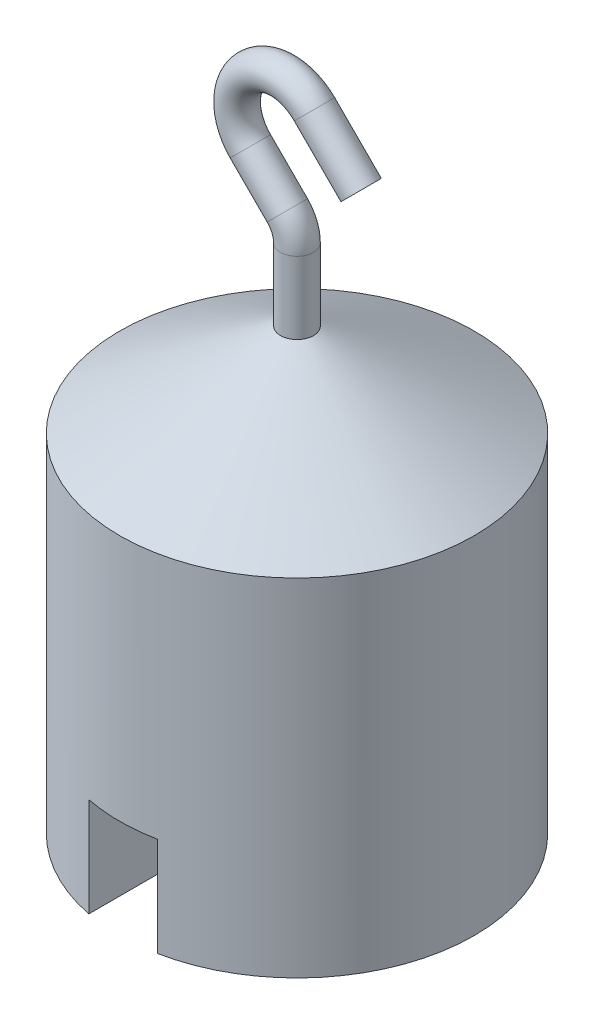
from build123d import *

# Parameters (mm, degrees)
SKETCH2_R               = 2
CUT_EXTRUDE1_DEPTH      = 94.938434637
CUT_EXTRUDE1_DEPTH_BACK = 94.938434637
SKETCH10_W              = 8.3
SKETCH10_H              = 12
BOSS_EXTRUDE1_REACH     = 89.369
SKETCH11_R              = 1.5
SKETCH13_W              = 15
SKETCH13_H              = 6
CUT_EXTRUDE2_DEPTH      = 1.25
CUT_EXTRUDE3_DEPTH      = 0.5


with BuildPart() as part:
    # Sketch1 → Revolve1 (revolve)
    with BuildSketch(Plane.XY):
        Polygon((0, 0), (0, 42), (19.5, 53.258330249), (21.5, 53.258330249), (21.5, 0), align=None)
    revolve(axis=Axis((21.5, 53.258330249, 0), (0, -1, 0)))

    # Sweep6: sweep along a path in Sketch3
    with BuildLine(Plane.XY) as sweep6_path:
        Line((29.278174593, 71.436504842), (23.621320344, 77.093359092))
        ThreePointArc((23.621320344, 77.093359092), (15.843145751, 77.093359092), (15.843145751, 69.315184499))
        Line((15.843145751, 69.315184499), (20.328427125, 64.829903124))
        ThreePointArc((20.328427125, 64.829903124), (21.19551813, 63.532209729), (21.5, 62.001476))
        Line((21.5, 62.001476), (21.5, 53.258330249))
    # Sketch2 → Sweep6 (sweep)
    with BuildSketch(Plane(origin=(0, 53.258330249, 0), x_dir=(1, 0, 0), z_dir=(0, 1, 0))):
        with Locations((21.5, 0)):
            Circle(SKETCH2_R)
    sweep(path=sweep6_path.line)

    # Sketch10 → Cut-Extrude1 (cut, two sides: drawn at the far end of the back side and taken through both)
    with BuildSketch(Plane.XY.offset(-CUT_EXTRUDE1_DEPTH_BACK)):
        with Locations((21.5, 6)):
            Rectangle(SKETCH10_W, SKETCH10_H)
    extrude(amount=CUT_EXTRUDE1_DEPTH + CUT_EXTRUDE1_DEPTH_BACK, mode=Mode.SUBTRACT)

    # Sketch11 → Boss-Extrude1 (add, up to next)
    with BuildSketch(Plane.ZY.offset(-25.65), mode=Mode.PRIVATE) as boss_extrude1_sk1:
        with Locations((0, 4.5)):
            Circle(SKETCH11_R)
    boss_extrude1_tool1 = extrude(boss_extrude1_sk1.sketch, amount=BOSS_EXTRUDE1_REACH, mode=Mode.PRIVATE) - part.part
    add(boss_extrude1_tool1.solids().sort_by_distance((25.65, 4.5, 0))[0])

    # Sketch13 → Cut-Extrude2 (cut)
    with BuildSketch(Plane.ZY):
        with Locations((0, 30)):
            Rectangle(SKETCH13_W, SKETCH13_H)
    extrude(amount=-CUT_EXTRUDE2_DEPTH, mode=Mode.SUBTRACT)

    # Sketch14 → Cut-Extrude3 (cut)
    # profile 1 of 4: a face of its own
    with BuildSketch(Plane.ZY.offset(-1.25)):
        with BuildLine():
            Line((-1.705128205, 31.5), (-1.705128205, 31.141025641))
            Line((-1.705128205, 31.141025641), (-2.895633013, 31.141025641))
            Line((-2.895633013, 31.141025641), (-3.084234776, 30.220452724))
            add(Edge.make_bspline(
                [(-3.084234776, 30.220452724), (-3.047178901, 30.230682996), (-2.975389005, 30.25050253), (-2.869429144, 30.2725083), (-2.768836941, 30.285773744), (-2.703561571, 30.287585055), (-2.67197516, 30.288461538)],
                knots=[0, 0, 0, 0, 1.100273476, 2.13160584, 3.095893838, 4, 4, 4, 4], degree=3))
            add(Edge.make_bspline(
                [(-2.67197516, 30.288461538), (-2.632891421, 30.287615603), (-2.556043023, 30.285952282), (-2.443604076, 30.269980432), (-2.336271183, 30.244840518), (-2.234268813, 30.209719996), (-2.137408262, 30.164810263), (-2.046580701, 30.108710322), (-1.960422788, 30.043176991), (-1.880480194, 29.967831979), (-1.807955886, 29.884910363), (-1.744189896, 29.795752492), (-1.690027306, 29.701224829), (-1.646466551, 29.600424221), (-1.611682216, 29.494465067), (-1.588530222, 29.382232485), (-1.573113513, 29.264784365), (-1.571391126, 29.184479795), (-1.570512821, 29.143529647)],
                knots=[0, 0, 0, 0, 1.052922333, 2.070308379, 3.05430497, 4.020497103, 4.973039431, 5.925935799, 6.892292201, 7.88610001, 8.88166317, 9.857072816, 10.836096531, 11.812156883, 12.81219415, 13.836441305, 14.89672472, 16, 16, 16, 16], degree=3))
            add(Edge.make_bspline(
                [(-1.570512821, 29.143529647), (-1.571177896, 29.115007427), (-1.572499058, 29.05834844), (-1.579217646, 28.974204239), (-1.592153362, 28.891841406), (-1.609521086, 28.811249014), (-1.632063504, 28.732579642), (-1.659352558, 28.655608114), (-1.692748586, 28.580813507), (-1.729379961, 28.507488112), (-1.770626439, 28.437289605), (-1.816404946, 28.371640618), (-1.864770437, 28.309556337), (-1.916811823, 28.251702604), (-1.973012818, 28.198459586), (-2.032692785, 28.149511304), (-2.095375504, 28.104029974), (-2.162030746, 28.063861779), (-2.231173229, 28.026898823), (-2.303801446, 27.996575285), (-2.378262147, 27.969464757), (-2.455627022, 27.94785523), (-2.535720835, 27.930922675), (-2.618675611, 27.919422075), (-2.704056281, 27.911045637), (-2.761931293, 27.91052128), (-2.791165865, 27.91025641)],
                knots=[0, 0, 0, 0, 1.056347294, 2.098418968, 3.122841568, 4.141288669, 5.149314143, 6.15115421, 7.162517403, 8.180376062, 9.185164535, 10.17417709, 11.141909838, 12.097768115, 13.052685741, 14.0056014, 14.954263652, 15.917497458, 16.885230207, 17.854509472, 18.828990115, 19.81800267, 20.826176721, 21.857883937, 22.917946725, 24, 24, 24, 24], degree=3))
            add(Edge.make_bspline(
                [(-2.791165865, 27.91025641), (-2.826040046, 27.910947248), (-2.894650877, 27.91230639), (-2.995171444, 27.926524876), (-3.09188605, 27.946888792), (-3.184016151, 27.977525062), (-3.272387414, 28.015912357), (-3.355810132, 28.064428528), (-3.436415908, 28.119407632), (-3.510927945, 28.184287985), (-3.580084058, 28.255203667), (-3.641990567, 28.332161308), (-3.697124144, 28.41389075), (-3.744601891, 28.500788904), (-3.785099912, 28.592627435), (-3.816914901, 28.689750436), (-3.842593256, 28.79165044), (-3.853456676, 28.86180395), (-3.858974359, 28.897435897)],
                knots=[0, 0, 0, 0, 1.0467383, 2.05933395, 3.04377827, 4.011590433, 4.970194871, 5.932262533, 6.905835911, 7.896367577, 8.894135286, 9.877477877, 10.858688626, 11.851381753, 12.8477658, 13.868841284, 14.917554742, 16, 16, 16, 16], degree=3))
            Line((-3.858974359, 28.897435897), (-3.544871795, 28.897435897))
            add(Edge.make_bspline(
                [(-3.544871795, 28.897435897), (-3.537143237, 28.864059445), (-3.522288521, 28.79990805), (-3.489682772, 28.709776709), (-3.449816897, 28.629457485), (-3.402412548, 28.557887902), (-3.345862518, 28.495478905), (-3.281333089, 28.439861843), (-3.208985366, 28.389686713), (-3.128592136, 28.347863946), (-3.043779057, 28.312195193), (-2.955011847, 28.288443498), (-2.8647075, 28.271742605), (-2.80362913, 28.270070844), (-2.772936699, 28.269230769)],
                knots=[0, 0, 0, 0, 1.136247022, 2.183929868, 3.172523383, 4.106158343, 5.02341133, 5.958108904, 6.928429099, 7.938127109, 8.96079061, 9.975095812, 10.982467395, 12, 12, 12, 12], degree=3))
            add(Edge.make_bspline(
                [(-2.772936699, 28.269230769), (-2.742978254, 28.270051547), (-2.683989832, 28.271667666), (-2.597178445, 28.284106678), (-2.513365571, 28.303264249), (-2.433378214, 28.331934104), (-2.355816675, 28.366778822), (-2.282642904, 28.411493898), (-2.211740027, 28.462953917), (-2.145311894, 28.521910547), (-2.084472445, 28.586880241), (-2.030716323, 28.656357635), (-1.98593941, 28.730474481), (-1.948205301, 28.807947634), (-1.919552002, 28.889626191), (-1.899111021, 28.975127366), (-1.887107962, 29.064662347), (-1.885456782, 29.125731656), (-1.884615385, 29.156850962)],
                knots=[0, 0, 0, 0, 1.027316725, 2.022795036, 3.002884548, 3.971462791, 4.93288096, 5.914575861, 6.907176829, 7.935150275, 8.956128384, 9.956726525, 10.942570165, 11.921478529, 12.907843606, 13.90538589, 14.932640048, 16, 16, 16, 16], degree=3))
            add(Edge.make_bspline(
                [(-1.884615385, 29.156850962), (-1.885273864, 29.184926713), (-1.886562744, 29.239881002), (-1.897093314, 29.320280209), (-1.915410287, 29.396353251), (-1.940834167, 29.468467485), (-1.973113674, 29.536690927), (-2.012559987, 29.601093987), (-2.059913385, 29.660827821), (-2.114005273, 29.715920374), (-2.173263314, 29.766765249), (-2.238707057, 29.810109336), (-2.308966983, 29.846573253), (-2.383196583, 29.878041252), (-2.463161482, 29.900641997), (-2.547278114, 29.917609882), (-2.636454822, 29.927425245), (-2.69742551, 29.928787134), (-2.728766026, 29.929487179)],
                knots=[0, 0, 0, 0, 1.045622112, 2.046656509, 3.013763289, 3.955457236, 4.890082067, 5.820317437, 6.762574623, 7.722996705, 8.69280354, 9.665887285, 10.63943826, 11.638615906, 12.663482002, 13.728887084, 14.832589034, 16, 16, 16, 16], degree=3))
            add(Edge.make_bspline(
                [(-2.728766026, 29.929487179), (-2.755894954, 29.928906588), (-2.81190931, 29.927707815), (-2.897832137, 29.918881318), (-2.988123859, 29.904642024), (-3.082438355, 29.885055776), (-3.181058863, 29.859424699), (-3.283777264, 29.828710199), (-3.39080953, 29.7919882), (-3.462927255, 29.764255986), (-3.5, 29.75)],
                knots=[0, 0, 0, 0, 0.817624296, 1.688186739, 2.600797293, 3.572016777, 4.590301741, 5.671205678, 6.80286297, 8, 8, 8, 8], degree=3))
            Line((-3.5, 29.75), (-3.141025641, 31.5))
            Line((-3.141025641, 31.5), (-1.705128205, 31.5))
        make_face()
    # profile 2 of 4: a face of its own
    with BuildSketch(Plane.ZY.offset(-1.25)):
        with BuildLine():
            add(Edge.make_bspline(
                [(-1.211538462, 29.748597756), (-1.211210443, 29.804695144), (-1.210573263, 29.913665128), (-1.203484842, 30.07244977), (-1.1917095, 30.221410059), (-1.175572127, 30.360553125), (-1.155934147, 30.48991489), (-1.12971866, 30.609149647), (-1.099905858, 30.718809254), (-1.065353412, 30.819251302), (-1.026365623, 30.911829005), (-0.983931362, 30.998254207), (-0.936366568, 31.078396139), (-0.886389655, 31.153533929), (-0.831977583, 31.222437624), (-0.774678793, 31.286080287), (-0.712256917, 31.342991037), (-0.646833908, 31.394837339), (-0.577817444, 31.440286811), (-0.507174778, 31.48031955), (-0.434419672, 31.514519417), (-0.359353489, 31.541409853), (-0.282650931, 31.5636207), (-0.204043864, 31.578809647), (-0.1234025, 31.588366556), (-0.068971066, 31.589280224), (-0.041366186, 31.58974359)],
                knots=[0, 0, 0, 0, 1.646270934, 3.197905019, 4.663502075, 6.030701355, 7.308322542, 8.50163776, 9.611534131, 10.641858119, 11.616356847, 12.558055219, 13.465016945, 14.349605745, 15.204443733, 16.039544428, 16.859896111, 17.680448484, 18.487036065, 19.28249412, 20.06191084, 20.843045899, 21.620316918, 22.403196591, 23.190181807, 24, 24, 24, 24], degree=3))
            add(Edge.make_bspline(
                [(-0.041366186, 31.58974359), (-0.013530707, 31.589255775), (0.041825301, 31.588285664), (0.123665677, 31.578961721), (0.203615358, 31.563490598), (0.281333497, 31.541569623), (0.357458484, 31.514373947), (0.431394891, 31.48028683), (0.503601973, 31.440607962), (0.57293226, 31.393984085), (0.640146876, 31.342001809), (0.703594839, 31.28323914), (0.763281925, 31.218289421), (0.81995723, 31.147847557), (0.872012827, 31.070562472), (0.921586259, 30.987778362), (0.965958295, 30.898047497), (1.008692971, 30.80286703), (1.045579957, 30.699603371), (1.078846203, 30.58883861), (1.105725171, 30.469264423), (1.128114443, 30.341508178), (1.145459339, 30.205100695), (1.158091981, 30.060334379), (1.164765067, 29.907113989), (1.166021768, 29.80235614), (1.166666667, 29.748597756)],
                knots=[0, 0, 0, 0, 0.810914788, 1.612654377, 2.396697861, 3.181598691, 3.963628158, 4.749916497, 5.551656086, 6.361998678, 7.18212741, 8.025565596, 8.878627764, 9.750805457, 10.657531673, 11.591944965, 12.560506719, 13.57287815, 14.630710178, 15.753379473, 16.941251878, 18.199788006, 19.531962791, 20.947069417, 22.433333509, 24, 24, 24, 24], degree=3))
            add(Edge.make_bspline(
                [(1.166666667, 29.748597756), (1.166015082, 29.695073848), (1.164745496, 29.590784697), (1.158166789, 29.438253721), (1.145208158, 29.294255678), (1.12899817, 29.158445216), (1.106547207, 29.031387597), (1.078942041, 28.912643148), (1.048291718, 28.801699077), (1.010456924, 28.699464265), (0.969046213, 28.604512542), (0.923991017, 28.515845394), (0.875721191, 28.432679101), (0.823132446, 28.355679354), (0.767079033, 28.284300697), (0.706361244, 28.219803074), (0.642690659, 28.160632402), (0.575278243, 28.107980775), (0.504866692, 28.06189597), (0.432907615, 28.02068212), (0.358124232, 27.987449425), (0.282211279, 27.958914384), (0.204082913, 27.937113932), (0.123836522, 27.922040077), (0.041880286, 27.911468228), (-0.013521279, 27.910661748), (-0.041366186, 27.91025641)],
                knots=[0, 0, 0, 0, 1.561518951, 3.042555995, 4.452378317, 5.7783523, 7.031515105, 8.214008947, 9.334062868, 10.386615937, 11.391082383, 12.354592575, 13.286541444, 14.194233754, 15.072674879, 15.931287219, 16.775624067, 17.606195743, 18.42308326, 19.229000347, 20.022332153, 20.807536673, 21.593273796, 22.3848459, 23.188221202, 24, 24, 24, 24], degree=3))
            add(Edge.make_bspline(
                [(-0.041366186, 27.91025641), (-0.0689703, 27.910722766), (-0.123400225, 27.911642328), (-0.20405265, 27.921156059), (-0.282335094, 27.936451562), (-0.358633848, 27.957868166), (-0.433340363, 27.984083003), (-0.505436649, 28.018236686), (-0.575724333, 28.057570755), (-0.644015889, 28.102366177), (-0.70902805, 28.15368786), (-0.771126655, 28.210452149), (-0.828751674, 28.27407556), (-0.88238577, 28.343553483), (-0.933359858, 28.418246725), (-0.980249232, 28.499175098), (-1.023620086, 28.586017709), (-1.063263576, 28.67933562), (-1.09841224, 28.780490547), (-1.129459948, 28.890639726), (-1.153974105, 29.010755362), (-1.174957061, 29.139872729), (-1.191881444, 29.278546659), (-1.203435769, 29.426852438), (-1.210577084, 29.584697647), (-1.211212155, 29.692967421), (-1.211538462, 29.748597756)],
                knots=[0, 0, 0, 0, 0.810891512, 1.598919785, 2.382837074, 3.152667961, 3.926044502, 4.706494248, 5.493654104, 6.291793342, 7.103789334, 7.925228297, 8.761435821, 9.622817696, 10.50288917, 11.416980706, 12.369136599, 13.353924996, 14.394355917, 15.514179734, 16.714354668, 17.994756427, 19.357759367, 20.818452758, 22.365282078, 24, 24, 24, 24], degree=3))
        make_face()
        with BuildLine():
            add(Edge.make_bspline(
                [(-0.897435897, 29.75), (-0.89731645, 29.703251301), (-0.897084627, 29.612521256), (-0.891028426, 29.480677995), (-0.882778194, 29.357707667), (-0.872136897, 29.24345413), (-0.856333949, 29.138304118), (-0.838627161, 29.041534435), (-0.817079071, 28.953657197), (-0.791584053, 28.874069387), (-0.762544957, 28.801420318), (-0.730839093, 28.733819103), (-0.69677837, 28.670467167), (-0.658659219, 28.611933558), (-0.617144156, 28.558027394), (-0.573170897, 28.507794562), (-0.525098313, 28.462997581), (-0.45859457, 28.409270726), (-0.370798096, 28.353751592), (-0.260177641, 28.305405502), (-0.14650919, 28.275023046), (-0.06935794, 28.27115929), (-0.030849359, 28.269230769)],
                knots=[0, 0, 0, 0, 1.459021318, 2.831673884, 4.118529203, 5.306027144, 6.411944654, 7.436330062, 8.375795394, 9.233974572, 10.042671642, 10.816086306, 11.563610507, 12.285937304, 12.993564865, 13.685989202, 14.367179055, 15.041617293, 16.353048772, 17.594441528, 18.799311195, 20, 20, 20, 20], degree=3))
            add(Edge.make_bspline(
                [(-0.030849359, 28.269230769), (0.007908313, 28.27082855), (0.085343636, 28.274020813), (0.198477431, 28.30481955), (0.308307701, 28.35128909), (0.394379641, 28.406236595), (0.459862185, 28.458564925), (0.506779175, 28.503179573), (0.549841223, 28.55313544), (0.590683298, 28.607034736), (0.628142374, 28.66590722), (0.662205512, 28.729469796), (0.693288859, 28.797898973), (0.710997905, 28.845668713), (0.720052083, 28.870092147)],
                knots=[0, 0, 0, 0, 1.353760809, 2.704726607, 4.075137775, 5.516104923, 6.260822281, 7.007110065, 7.778089737, 8.566572457, 9.372053459, 10.217411131, 11.088608312, 12, 12, 12, 12], degree=3))
            add(Edge.make_bspline(
                [(0.720052083, 28.870092147), (0.730603851, 28.901321887), (0.752028465, 28.964731651), (0.779640239, 29.063095303), (0.801385638, 29.166298067), (0.820949004, 29.273723184), (0.83430206, 29.386162885), (0.845049873, 29.503269269), (0.85138056, 29.625130631), (0.852165311, 29.707925622), (0.852564103, 29.75)],
                knots=[0, 0, 0, 0, 0.884706709, 1.796334032, 2.740027952, 3.714592787, 4.726048262, 5.777819803, 6.87074269, 8, 8, 8, 8], degree=3))
            add(Edge.make_bspline(
                [(0.852564103, 29.75), (0.852013913, 29.792067573), (0.850937626, 29.874360737), (0.846823638, 29.994878918), (0.836200063, 30.109346679), (0.824400945, 30.218257152), (0.807003723, 30.321007454), (0.788245917, 30.418457759), (0.763044704, 30.509400784), (0.736124929, 30.595260366), (0.705314534, 30.675061021), (0.671398799, 30.749174807), (0.635177041, 30.817959532), (0.5958348, 30.881226473), (0.553839117, 30.939259016), (0.508081568, 30.990893611), (0.460377195, 31.037730579), (0.393560009, 31.091193148), (0.30608572, 31.145704843), (0.197240072, 31.195870603), (0.083969428, 31.224678896), (0.007395974, 31.228740583), (-0.030849359, 31.230769231)],
                knots=[0, 0, 0, 0, 1.31362396, 2.569729283, 3.763502607, 4.902122613, 5.988968491, 7.01645872, 7.998833611, 8.933434873, 9.825090667, 10.667526885, 11.477055099, 12.250526234, 12.991942729, 13.710640831, 14.402115721, 15.076753259, 16.378508321, 17.609869233, 18.806226677, 20, 20, 20, 20], degree=3))
            add(Edge.make_bspline(
                [(-0.030849359, 31.230769231), (-0.069559951, 31.228737784), (-0.147051657, 31.22467119), (-0.261499611, 31.195977936), (-0.371203963, 31.14596497), (-0.458446938, 31.091012598), (-0.525310724, 31.038674287), (-0.572393418, 30.993287833), (-0.61653959, 30.943641578), (-0.65720729, 30.889239663), (-0.695296573, 30.830774296), (-0.730277586, 30.767785531), (-0.761794915, 30.699954167), (-0.790879452, 30.627337732), (-0.81645224, 30.547756787), (-0.837546203, 30.459987794), (-0.857033256, 30.363525902), (-0.870828525, 30.257806394), (-0.883092281, 30.14352424), (-0.890973629, 30.020246922), (-0.897104886, 29.888182542), (-0.89732335, 29.796983383), (-0.897435897, 29.75)],
                knots=[0, 0, 0, 0, 1.207732386, 2.417664972, 3.655092373, 4.956220595, 5.625982001, 6.301752483, 6.994047911, 7.697131622, 8.419323945, 9.170223765, 9.943494443, 10.752040957, 11.610060368, 12.549350801, 13.567764191, 14.679664412, 15.874934091, 17.154273443, 18.533957287, 20, 20, 20, 20], degree=3))
        make_face(mode=Mode.SUBTRACT)
    # profile 3 of 4: a face of its own
    with BuildSketch(Plane.ZY.offset(-1.25)):
        with BuildLine():
            add(Edge.make_bspline(
                [(1.480769231, 29.748597756), (1.481097249, 29.804695144), (1.481734429, 29.913665128), (1.48882285, 30.07244977), (1.500598192, 30.221410059), (1.516735565, 30.360553125), (1.536373545, 30.48991489), (1.562589032, 30.609149647), (1.592401834, 30.718809254), (1.62695428, 30.819251302), (1.665942069, 30.911829005), (1.70837633, 30.998254207), (1.755941124, 31.078396139), (1.805918037, 31.153533929), (1.860330109, 31.222437624), (1.917628899, 31.286080287), (1.980050776, 31.342991037), (2.045473784, 31.394837339), (2.114490248, 31.440286811), (2.185132915, 31.48031955), (2.25788802, 31.514519417), (2.332954203, 31.541409853), (2.409656761, 31.5636207), (2.488263828, 31.578809647), (2.568905192, 31.588366556), (2.623336627, 31.589280224), (2.650941506, 31.58974359)],
                knots=[0, 0, 0, 0, 1.646270934, 3.197905019, 4.663502075, 6.030701355, 7.308322542, 8.50163776, 9.611534131, 10.641858119, 11.616356847, 12.558055219, 13.465016945, 14.349605745, 15.204443733, 16.039544428, 16.859896111, 17.680448484, 18.487036065, 19.28249412, 20.06191084, 20.843045899, 21.620316918, 22.403196591, 23.190181807, 24, 24, 24, 24], degree=3))
            add(Edge.make_bspline(
                [(2.650941506, 31.58974359), (2.678776985, 31.589255775), (2.734132994, 31.588285664), (2.815973369, 31.578961721), (2.895923051, 31.563490598), (2.973641189, 31.541569623), (3.049766176, 31.514373947), (3.123702584, 31.48028683), (3.195909665, 31.440607962), (3.265239953, 31.393984085), (3.332454568, 31.342001809), (3.395902531, 31.28323914), (3.455589617, 31.218289421), (3.512264922, 31.147847557), (3.56432052, 31.070562472), (3.613893952, 30.987778362), (3.658265988, 30.898047497), (3.701000663, 30.80286703), (3.73788765, 30.699603371), (3.771153895, 30.58883861), (3.798032863, 30.469264423), (3.820422136, 30.341508178), (3.837767032, 30.205100695), (3.850399674, 30.060334379), (3.857072759, 29.907113989), (3.85832946, 29.80235614), (3.858974359, 29.748597756)],
                knots=[0, 0, 0, 0, 0.810914788, 1.612654377, 2.396697861, 3.181598691, 3.963628158, 4.749916497, 5.551656086, 6.361998678, 7.18212741, 8.025565596, 8.878627764, 9.750805457, 10.657531673, 11.591944965, 12.560506719, 13.57287815, 14.630710178, 15.753379473, 16.941251878, 18.199788006, 19.531962791, 20.947069417, 22.433333509, 24, 24, 24, 24], degree=3))
            add(Edge.make_bspline(
                [(3.858974359, 29.748597756), (3.858322774, 29.695073848), (3.857053189, 29.590784697), (3.850474482, 29.438253721), (3.837515851, 29.294255678), (3.821305862, 29.158445216), (3.798854899, 29.031387597), (3.771249733, 28.912643148), (3.74059941, 28.801699077), (3.702764616, 28.699464265), (3.661353906, 28.604512542), (3.61629871, 28.515845394), (3.568028883, 28.432679101), (3.515440138, 28.355679354), (3.459386725, 28.284300697), (3.398668937, 28.219803074), (3.334998351, 28.160632402), (3.267585936, 28.107980775), (3.197174384, 28.06189597), (3.125215307, 28.02068212), (3.050431924, 27.987449425), (2.974518971, 27.958914384), (2.896390605, 27.937113932), (2.816144215, 27.922040077), (2.734187979, 27.911468228), (2.678786414, 27.910661748), (2.650941506, 27.91025641)],
                knots=[0, 0, 0, 0, 1.561518951, 3.042555995, 4.452378317, 5.7783523, 7.031515105, 8.214008947, 9.334062868, 10.386615937, 11.391082383, 12.354592575, 13.286541444, 14.194233754, 15.072674879, 15.931287219, 16.775624067, 17.606195743, 18.42308326, 19.229000347, 20.022332153, 20.807536673, 21.593273796, 22.3848459, 23.188221202, 24, 24, 24, 24], degree=3))
            add(Edge.make_bspline(
                [(2.650941506, 27.91025641), (2.623337392, 27.910722766), (2.568907468, 27.911642328), (2.488255042, 27.921156059), (2.409972599, 27.936451562), (2.333673845, 27.957868166), (2.25896733, 27.984083003), (2.186871043, 28.018236686), (2.116583359, 28.057570755), (2.048291803, 28.102366177), (1.983279642, 28.15368786), (1.921181037, 28.210452149), (1.863556018, 28.27407556), (1.809921922, 28.343553483), (1.758947834, 28.418246725), (1.712058461, 28.499175098), (1.668687607, 28.586017709), (1.629044116, 28.67933562), (1.593895452, 28.780490547), (1.562847744, 28.890639726), (1.538333587, 29.010755362), (1.517350632, 29.139872729), (1.500426248, 29.278546659), (1.488871923, 29.426852438), (1.481730608, 29.584697647), (1.481095538, 29.692967421), (1.480769231, 29.748597756)],
                knots=[0, 0, 0, 0, 0.810891512, 1.598919785, 2.382837074, 3.152667961, 3.926044502, 4.706494248, 5.493654104, 6.291793342, 7.103789334, 7.925228297, 8.761435821, 9.622817696, 10.50288917, 11.416980706, 12.369136599, 13.353924996, 14.394355917, 15.514179734, 16.714354668, 17.994756427, 19.357759367, 20.818452758, 22.365282078, 24, 24, 24, 24], degree=3))
        make_face()
        with BuildLine():
            add(Edge.make_bspline(
                [(1.794871795, 29.75), (1.794991242, 29.703251301), (1.795223065, 29.612521256), (1.801279266, 29.480677995), (1.809529498, 29.357707667), (1.820170795, 29.24345413), (1.835973744, 29.138304118), (1.853680531, 29.041534435), (1.875228621, 28.953657197), (1.900723639, 28.874069387), (1.929762736, 28.801420318), (1.961468599, 28.733819103), (1.995529322, 28.670467167), (2.033648473, 28.611933558), (2.075163536, 28.558027394), (2.119136795, 28.507794562), (2.167209379, 28.462997581), (2.233713122, 28.409270726), (2.321509596, 28.353751592), (2.432130052, 28.305405502), (2.545798503, 28.275023046), (2.622949753, 28.27115929), (2.661458333, 28.269230769)],
                knots=[0, 0, 0, 0, 1.459021318, 2.831673884, 4.118529203, 5.306027144, 6.411944654, 7.436330062, 8.375795394, 9.233974572, 10.042671642, 10.816086306, 11.563610507, 12.285937304, 12.993564865, 13.685989202, 14.367179055, 15.041617293, 16.353048772, 17.594441528, 18.799311195, 20, 20, 20, 20], degree=3))
            add(Edge.make_bspline(
                [(2.661458333, 28.269230769), (2.700216005, 28.27082855), (2.777651328, 28.274020813), (2.890785123, 28.30481955), (3.000615393, 28.35128909), (3.086687334, 28.406236595), (3.152169877, 28.458564925), (3.199086867, 28.503179573), (3.242148916, 28.55313544), (3.282990991, 28.607034736), (3.320450066, 28.66590722), (3.354513204, 28.729469796), (3.385596551, 28.797898973), (3.403305597, 28.845668713), (3.412359776, 28.870092147)],
                knots=[0, 0, 0, 0, 1.353760809, 2.704726607, 4.075137775, 5.516104923, 6.260822281, 7.007110065, 7.778089737, 8.566572457, 9.372053459, 10.217411131, 11.088608312, 12, 12, 12, 12], degree=3))
            add(Edge.make_bspline(
                [(3.412359776, 28.870092147), (3.422911543, 28.901321887), (3.444336157, 28.964731651), (3.471947932, 29.063095303), (3.493693331, 29.166298067), (3.513256696, 29.273723184), (3.526609752, 29.386162885), (3.537357566, 29.503269269), (3.543688253, 29.625130631), (3.544473004, 29.707925622), (3.544871795, 29.75)],
                knots=[0, 0, 0, 0, 0.884706709, 1.796334032, 2.740027952, 3.714592787, 4.726048262, 5.777819803, 6.87074269, 8, 8, 8, 8], degree=3))
            add(Edge.make_bspline(
                [(3.544871795, 29.75), (3.544321606, 29.792067573), (3.543245318, 29.874360737), (3.53913133, 29.994878918), (3.528507756, 30.109346679), (3.516708637, 30.218257152), (3.499311416, 30.321007454), (3.480553609, 30.418457759), (3.455352397, 30.509400784), (3.428432622, 30.595260366), (3.397622226, 30.675061021), (3.363706492, 30.749174807), (3.327484733, 30.817959532), (3.288142493, 30.881226473), (3.24614681, 30.939259016), (3.20038926, 30.990893611), (3.152684887, 31.037730579), (3.085867702, 31.091193148), (2.998393412, 31.145704843), (2.889547765, 31.195870603), (2.77627712, 31.224678896), (2.699703666, 31.228740583), (2.661458333, 31.230769231)],
                knots=[0, 0, 0, 0, 1.31362396, 2.569729283, 3.763502607, 4.902122613, 5.988968491, 7.01645872, 7.998833611, 8.933434873, 9.825090667, 10.667526885, 11.477055099, 12.250526234, 12.991942729, 13.710640831, 14.402115721, 15.076753259, 16.378508321, 17.609869233, 18.806226677, 20, 20, 20, 20], degree=3))
            add(Edge.make_bspline(
                [(2.661458333, 31.230769231), (2.622747741, 31.228737784), (2.545256036, 31.22467119), (2.430808081, 31.195977936), (2.321103729, 31.14596497), (2.233860755, 31.091012598), (2.166996968, 31.038674287), (2.119914275, 30.993287833), (2.075768102, 30.943641578), (2.035100402, 30.889239663), (1.997011119, 30.830774296), (1.962030107, 30.767785531), (1.930512777, 30.699954167), (1.901428241, 30.627337732), (1.875855453, 30.547756787), (1.854761489, 30.459987794), (1.835274436, 30.363525902), (1.821479167, 30.257806394), (1.809215412, 30.14352424), (1.801334064, 30.020246922), (1.795202806, 29.888182542), (1.794984342, 29.796983383), (1.794871795, 29.75)],
                knots=[0, 0, 0, 0, 1.207732386, 2.417664972, 3.655092373, 4.956220595, 5.625982001, 6.301752483, 6.994047911, 7.697131622, 8.419323945, 9.170223765, 9.943494443, 10.752040957, 11.610060368, 12.549350801, 13.567764191, 14.679664412, 15.874934091, 17.154273443, 18.533957287, 20, 20, 20, 20], degree=3))
        make_face(mode=Mode.SUBTRACT)
    # profile 4 of 4: a face of its own
    with BuildSketch(Plane.ZY.offset(-1.25)):
        with BuildLine():
            add(Edge.make_bspline(
                [(4.71063496, 30.25748531), (4.710833333, 30.291410873), (4.711218675, 30.357311768), (4.715505482, 30.453338671), (4.72262676, 30.543424179), (4.732386029, 30.627572604), (4.744262331, 30.705805672), (4.760116459, 30.77791431), (4.778146106, 30.844232263), (4.799042109, 30.904975788), (4.822620438, 30.960963256), (4.848283063, 31.013229925), (4.877048438, 31.061696713), (4.907272571, 31.107137186), (4.94017892, 31.148807516), (4.974831045, 31.187296173), (5.012581418, 31.221713627), (5.052146761, 31.253068296), (5.09388529, 31.280554405), (5.136607283, 31.30476468), (5.180606799, 31.325447457), (5.226003967, 31.341709768), (5.272390752, 31.355142042), (5.319929311, 31.364327739), (5.368698136, 31.370107393), (5.401616195, 31.370659945), (5.418310574, 31.370940171)],
                knots=[0, 0, 0, 0, 1.646270934, 3.197905019, 4.663502075, 6.030701355, 7.308322542, 8.50163776, 9.611534131, 10.641858119, 11.616356847, 12.558055219, 13.465016945, 14.349605745, 15.204443733, 16.039544428, 16.859896111, 17.680448484, 18.487036065, 19.28249412, 20.06191084, 20.843045899, 21.620316918, 22.403196591, 23.190181807, 24, 24, 24, 24], degree=3))
            add(Edge.make_bspline(
                [(5.418310574, 31.370940171), (5.435144411, 31.370645159), (5.468621617, 31.370058473), (5.518115558, 31.364419708), (5.56646608, 31.355063362), (5.613467049, 31.341806391), (5.659504541, 31.325359482), (5.704218464, 31.304744892), (5.747886556, 31.280748625), (5.789814873, 31.25255228), (5.830463711, 31.22111538), (5.868834622, 31.185577956), (5.904931098, 31.14629884), (5.939206164, 31.103698284), (5.970687406, 31.056959209), (6.000667529, 31.006894533), (6.027502046, 30.952628725), (6.05334635, 30.895067204), (6.075654194, 30.832617277), (6.095772352, 30.765630969), (6.112027728, 30.693317056), (6.125567907, 30.616054946), (6.13605744, 30.533560896), (6.14369718, 30.446011744), (6.147732808, 30.353349888), (6.148492813, 30.289996332), (6.148882823, 30.25748531)],
                knots=[0, 0, 0, 0, 0.810914788, 1.612654377, 2.396697861, 3.181598691, 3.963628158, 4.749916497, 5.551656086, 6.361998678, 7.18212741, 8.025565596, 8.878627764, 9.750805457, 10.657531673, 11.591944965, 12.560506719, 13.57287815, 14.630710178, 15.753379473, 16.941251878, 18.199788006, 19.531962791, 20.947069417, 22.433333509, 24, 24, 24, 24], degree=3))
            add(Edge.make_bspline(
                [(6.148882823, 30.25748531), (6.14848877, 30.225116089), (6.147720972, 30.162045983), (6.143742421, 30.06980106), (6.135905535, 29.982716529), (6.126102351, 29.900583535), (6.112524864, 29.823743928), (6.095830311, 29.751931809), (6.077294164, 29.684837061), (6.054413121, 29.623009341), (6.029369501, 29.565586156), (6.002121835, 29.511963643), (5.972930083, 29.461667837), (5.941126414, 29.415101324), (5.907227445, 29.371934231), (5.870507639, 29.332928526), (5.832002095, 29.297144358), (5.791233634, 29.265302659), (5.74865141, 29.237432325), (5.705133301, 29.212507758), (5.65990716, 29.19240989), (5.613997898, 29.175152985), (5.566748839, 29.161968902), (5.518218879, 29.152852808), (5.468654869, 29.146459357), (5.435150113, 29.145971629), (5.418310574, 29.145726496)],
                knots=[0, 0, 0, 0, 1.561518951, 3.042555995, 4.452378317, 5.7783523, 7.031515105, 8.214008947, 9.334062868, 10.386615937, 11.391082383, 12.354592575, 13.286541444, 14.194233754, 15.072674879, 15.931287219, 16.775624067, 17.606195743, 18.42308326, 19.229000347, 20.022332153, 20.807536673, 21.593273796, 22.3848459, 23.188221202, 24, 24, 24, 24], degree=3))
            add(Edge.make_bspline(
                [(5.418310574, 29.145726496), (5.401616658, 29.14600853), (5.368699513, 29.146564646), (5.319923998, 29.152318188), (5.272581759, 29.161568326), (5.226439179, 29.174520272), (5.181259524, 29.190374006), (5.137658437, 29.211028853), (5.095151123, 29.2348166), (5.053850992, 29.261907164), (5.014534113, 29.292944563), (4.976979243, 29.327273442), (4.942129826, 29.365750458), (4.909693969, 29.407768059), (4.878866782, 29.452939686), (4.850509875, 29.501882083), (4.824280835, 29.554401186), (4.800305962, 29.610836303), (4.779049389, 29.67201095), (4.760272918, 29.738624977), (4.74544769, 29.811266338), (4.732757997, 29.889351603), (4.722522775, 29.973216313), (4.71553516, 30.062905998), (4.711216364, 30.158364767), (4.710832298, 30.223842202), (4.71063496, 30.25748531)],
                knots=[0, 0, 0, 0, 0.810891512, 1.598919785, 2.382837074, 3.152667961, 3.926044502, 4.706494248, 5.493654104, 6.291793342, 7.103789334, 7.925228297, 8.761435821, 9.622817696, 10.50288917, 11.416980706, 12.369136599, 13.353924996, 14.394355917, 15.514179734, 16.714354668, 17.994756427, 19.357759367, 20.818452758, 22.365282078, 24, 24, 24, 24], degree=3))
        make_face()
        with BuildLine():
            add(Edge.make_bspline(
                [(4.900592225, 30.258333333), (4.900664462, 30.230061501), (4.90080466, 30.175191426), (4.904467219, 30.095457645), (4.909456645, 30.021089875), (4.915892096, 29.951993688), (4.925449118, 29.888402966), (4.936157508, 29.829880349), (4.949188972, 29.776735543), (4.964607388, 29.728603867), (4.982169127, 29.684668478), (5.001343626, 29.643785839), (5.021942253, 29.605473001), (5.044995263, 29.570074104), (5.070101992, 29.53747371), (5.096695344, 29.507094806), (5.125767812, 29.480003299), (5.165986742, 29.447511344), (5.219082705, 29.413935486), (5.285981742, 29.384697613), (5.354724091, 29.366323461), (5.401382228, 29.363986808), (5.42467075, 29.362820513)],
                knots=[0, 0, 0, 0, 1.459021318, 2.831673884, 4.118529203, 5.306027144, 6.411944654, 7.436330062, 8.375795394, 9.233974572, 10.042671642, 10.816086306, 11.563610507, 12.285937304, 12.993564865, 13.685989202, 14.367179055, 15.041617293, 16.353048772, 17.594441528, 18.799311195, 20, 20, 20, 20], degree=3))
            add(Edge.make_bspline(
                [(5.42467075, 29.362820513), (5.448109914, 29.36378679), (5.494939847, 29.365717349), (5.563358857, 29.384343252), (5.62978002, 29.412446259), (5.681833051, 29.445676417), (5.721434398, 29.477322597), (5.749808007, 29.504303837), (5.775850293, 29.534515242), (5.800550024, 29.567111483), (5.823203846, 29.602715319), (5.843803934, 29.641155543), (5.862601959, 29.682538903), (5.873311715, 29.711428221), (5.878787337, 29.726198584)],
                knots=[0, 0, 0, 0, 1.353760809, 2.704726607, 4.075137775, 5.516104923, 6.260822281, 7.007110065, 7.778089737, 8.566572457, 9.372053459, 10.217411131, 11.088608312, 12, 12, 12, 12], degree=3))
            add(Edge.make_bspline(
                [(5.878787337, 29.726198584), (5.885168644, 29.745085141), (5.898125434, 29.783432951), (5.914823984, 29.842919541), (5.927974773, 29.905332641), (5.939805951, 29.970299259), (5.947881371, 30.038298507), (5.954381239, 30.109119986), (5.958209797, 30.182817096), (5.958684384, 30.232888352), (5.958925558, 30.258333333)],
                knots=[0, 0, 0, 0, 0.884706709, 1.796334032, 2.740027952, 3.714592787, 4.726048262, 5.777819803, 6.87074269, 8, 8, 8, 8], degree=3))
            add(Edge.make_bspline(
                [(5.958925558, 30.258333333), (5.958592825, 30.283774199), (5.957941927, 30.33354197), (5.955453944, 30.406426774), (5.949029211, 30.475652515), (5.941893553, 30.54151742), (5.931372377, 30.603656889), (5.920028369, 30.662591121), (5.904787636, 30.717589998), (5.888507582, 30.769514602), (5.869874628, 30.817774998), (5.849363684, 30.862596193), (5.827458145, 30.904194574), (5.803665456, 30.94245601), (5.778268067, 30.977551881), (5.750595644, 31.008778517), (5.721745857, 31.037103731), (5.681337368, 31.069435856), (5.62843625, 31.102402453), (5.562610549, 31.132740793), (5.494108779, 31.150162951), (5.447800071, 31.152619305), (5.42467075, 31.153846154)],
                knots=[0, 0, 0, 0, 1.31362396, 2.569729283, 3.763502607, 4.902122613, 5.988968491, 7.01645872, 7.998833611, 8.933434873, 9.825090667, 10.667526885, 11.477055099, 12.250526234, 12.991942729, 13.710640831, 14.402115721, 15.076753259, 16.378508321, 17.609869233, 18.806226677, 20, 20, 20, 20], degree=3))
            add(Edge.make_bspline(
                [(5.42467075, 31.153846154), (5.401260059, 31.152617612), (5.354396028, 31.150158291), (5.285182264, 31.132805704), (5.218837252, 31.102559768), (5.166076024, 31.069326666), (5.125639353, 31.03767445), (5.097165534, 31.010226451), (5.070467611, 30.980202288), (5.045873335, 30.947302082), (5.022838388, 30.911944455), (5.001683204, 30.87385125), (4.982622724, 30.832829425), (4.965033504, 30.788913771), (4.949568056, 30.740786247), (4.936811231, 30.687706904), (4.925026203, 30.629370426), (4.91668335, 30.565435295), (4.909266698, 30.496321803), (4.904500359, 30.421768377), (4.900792408, 30.341900871), (4.900660289, 30.286747094), (4.900592225, 30.258333333)],
                knots=[0, 0, 0, 0, 1.207732386, 2.417664972, 3.655092373, 4.956220595, 5.625982001, 6.301752483, 6.994047911, 7.697131622, 8.419323945, 9.170223765, 9.943494443, 10.752040957, 11.610060368, 12.549350801, 13.567764191, 14.679664412, 15.874934091, 17.154273443, 18.533957287, 20, 20, 20, 20], degree=3))
        make_face(mode=Mode.SUBTRACT)
    extrude(amount=-CUT_EXTRUDE3_DEPTH, mode=Mode.SUBTRACT)


solid = part.part
